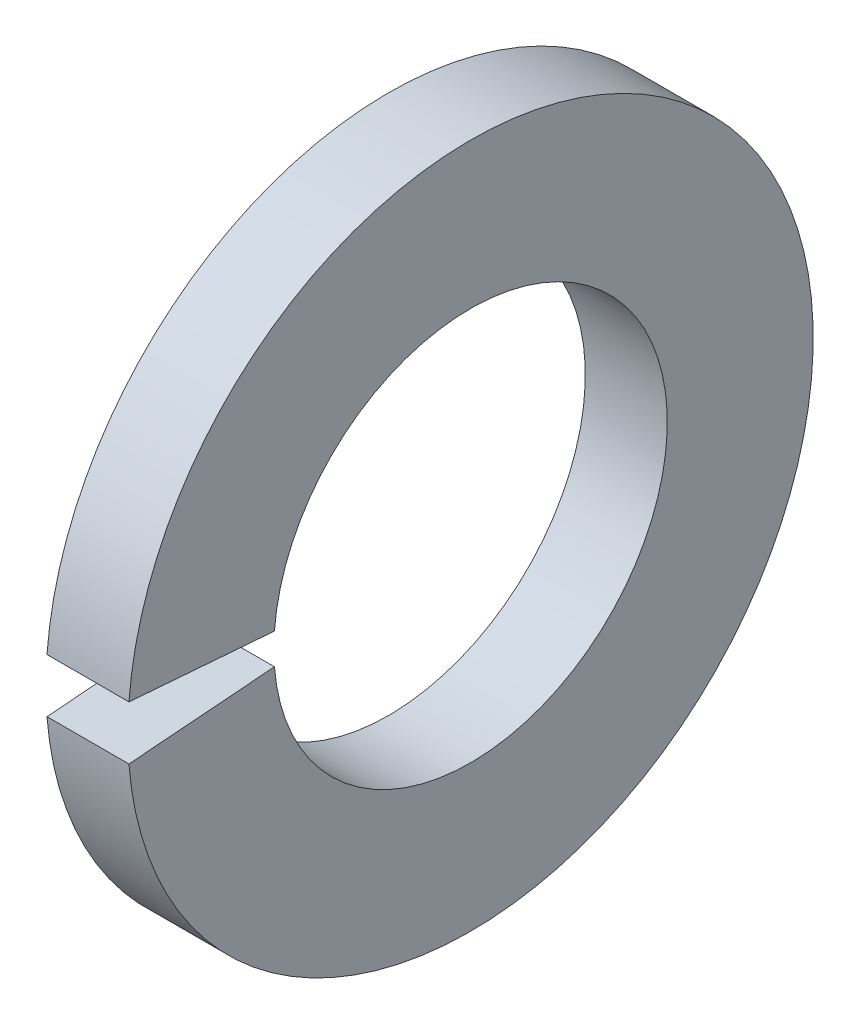
from build123d import *

# Parameters (mm, degrees)
SKETCH1_W = 0.635
SKETCH1_H = 1.1303
GAP_DEPTH = 4.807077879


with BuildPart() as part:
    # Sketch1 → Base-Revolve (revolve)
    with BuildSketch(Plane.XY):
        with Locations((-0.3175, 2.08915)):
            Rectangle(SKETCH1_W, SKETCH1_H)
    revolve(axis=Axis((-34.925, 0, 0), (1, 0, 0)))

    # Sketch2 → Gap (cut, through all)
    with BuildSketch(Plane(origin=(0, 0, 0), x_dir=(0, -1, 0), z_dir=(-1, 0, 0))):
        with BuildLine():
            Line((0, 0), (0.212419057, 2.699040033))
            ThreePointArc((0.212419057, 2.699040033), (0, 2.707386), (-0.212419057, 2.699040033))
            Line((-0.212419057, 2.699040033), (0, 0))
        make_face()
    extrude(amount=GAP_DEPTH, mode=Mode.SUBTRACT)


solid = part.part
